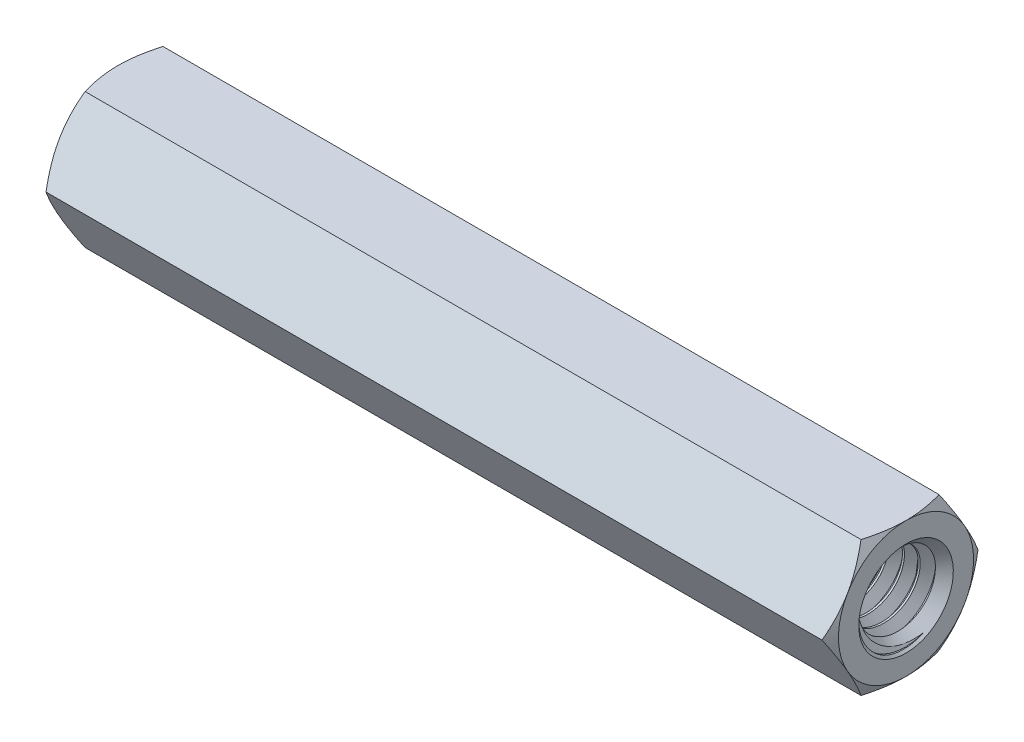
from build123d import *
from build123d.topology import SkipClean

# Parameters (mm, degrees)
BOSS_EXTRUDE1_DEPTH          = 35
SKETCH4_OUTSIDE_W            = 141.906
SKETCH4_OUTSIDE_H            = 140.978
SKETCH4_OUTSIDE_R            = 3
CUT_EXTRUDE1_DEPTH           = 36.298725189
CUT_EXTRUDE1_DRAFT           = -60
SKETCH5_OUTSIDE_W            = 141.906
SKETCH5_OUTSIDE_H            = 140.978
SKETCH5_OUTSIDE_R            = 3
CUT_EXTRUDE2_DEPTH           = 36.298725189
CUT_EXTRUDE2_DRAFT           = -60
SWEEP1_PITCH                 = 0.7
LPATTERN1_COUNT              = 2
LPATTERN1_PITCH              = 24
SKETCH8_R                    = 2.1
CUT_EXTRUDE3_OTHER_WAY_DEPTH = 37.017969724
CUT_EXTRUDE3_OTHER_WAY_TAPER = -45
SKETCH9_R                    = 2.1
CUT_EXTRUDE4_OTHER_WAY_DEPTH = 36.298725289
CUT_EXTRUDE4_OTHER_WAY_TAPER = -45


with BuildPart() as part:
    # Sketch2 → Boss-Extrude1 (new body)
    with BuildSketch(Plane(origin=(0, 0, 0), x_dir=(0, 0, -1), z_dir=(1, 0, 0))):
        Polygon((1.732050808, 3), (-1.732050808, 3), (-3.464101615, 0), (-1.732050808, -3), (1.732050808, -3), (3.464101615, 0), align=None)
    extrude(amount=BOSS_EXTRUDE1_DEPTH)

    # Sketch3 → Cut-Revolve1 (revolve, cut)
    with BuildSketch(Plane.XY, mode=Mode.PRIVATE) as cut_revolve1_sk:
        Polygon((0, 2.1), (0.1, 2), (11, 2), (11, 0), (0, 0), align=None)
        Polygon((35, 0), (24, 0), (24, 2), (34.9, 2), (35, 2.1), align=None)
    revolve(cut_revolve1_sk.sketch.rotate(Axis((0, 0, 0), (1, 0, 0)), 180), axis=Axis((0, 0, 0), (1, 0, 0)), mode=Mode.SUBTRACT)


with BuildPart() as cut_extrude1_tool:
    # Sketch4 outside → Cut-Extrude1 (with draft: the straight prism first)
    with BuildSketch(Plane.ZY):
        Rectangle(SKETCH4_OUTSIDE_W, SKETCH4_OUTSIDE_H)
        Circle(SKETCH4_OUTSIDE_R, mode=Mode.SUBTRACT)
    extrude(amount=-CUT_EXTRUDE1_DEPTH)
    # Cut-Extrude1: the draft: its side faces are tilted about the plane it starts from
    cut_extrude1_sides = [cut_extrude1_tool.faces().sort_by_distance(p)[0] for p in [
        (18.149362595, -70.489, 0),
        (18.149362595, 0, 70.953),
        (18.149362595, 70.489, 0),
        (18.149362595, 0, -70.953),
        (18.149362595, 0, -3),
    ]]
    draft(cut_extrude1_sides, Plane.ZY, CUT_EXTRUDE1_DRAFT)


with BuildPart() as part_1:
    add(part.part)

    # Cut-Extrude1: cut by cut_extrude1_tool
    add(cut_extrude1_tool.part, mode=Mode.SUBTRACT)


with BuildPart() as cut_extrude2_tool:
    # Sketch5 outside → Cut-Extrude2 (with draft: the straight prism first)
    with BuildSketch(Plane(origin=(35, 0, 0), x_dir=(0, 0, -1), z_dir=(1, 0, 0))):
        Rectangle(SKETCH5_OUTSIDE_W, SKETCH5_OUTSIDE_H)
        Circle(SKETCH5_OUTSIDE_R, mode=Mode.SUBTRACT)
    extrude(amount=-CUT_EXTRUDE2_DEPTH)
    # Cut-Extrude2: the draft: its side faces are tilted about the plane it starts from
    cut_extrude2_sides = [cut_extrude2_tool.faces().sort_by_distance(p)[0] for p in [
        (16.850637405, -70.489, 0),
        (16.850637405, 0, -70.953),
        (16.850637405, 70.489, 0),
        (16.850637405, 0, 70.953),
        (16.850637405, 0, 3),
    ]]
    draft(cut_extrude2_sides, Plane(origin=(35, 0, 0), x_dir=(0, 0, -1), z_dir=(1, 0, 0)), CUT_EXTRUDE2_DRAFT)


with BuildPart() as part_2:
    add(part_1.part)

    # Cut-Extrude2: cut by cut_extrude2_tool
    add(cut_extrude2_tool.part, mode=Mode.SUBTRACT)


with BuildPart() as body_2:
    # Sweep1: arcs per turn and ends read off the stored shape
    # Sweep1: the profile of Sketch6 screwed along a right-hand helix through 16.714286 turns, 6 arcs to a turn; built about Z, then put on its axis
    sweep1_z = Axis((0, 0, 0), (0, 0, 1))
    sweep1_corners = [(2.04375, 0, -0.624222777), (2.04375, 0, 0.025259074), (1.55705944, 0, -0.255731851), (1.55705944, 0, -0.343231851)]
    with BuildLine(mode=Mode.PRIVATE) as sweep1_profile:
        Line(sweep1_corners[0], sweep1_corners[1])
        Line(sweep1_corners[1], sweep1_corners[2])
        Line(sweep1_corners[2], sweep1_corners[3])
        Line(sweep1_corners[3], sweep1_corners[0])
    sweep1_cap = Face(sweep1_profile.wire())
    sweep1_turn_angles = [0, 30, 60, 90, 120, 150, 180, 210, 240, 270, 300, 330, 360]
    sweep1_turn_weights = [1, 0.8660254037844387, 1, 0.8660254037844387, 1, 0.8660254037844387, 1, 0.8660254037844387, 1, 0.8660254037844387, 1, 0.8660254037844387, 1]
    sweep1_turn_rails = [Edge.make_bspline([Vector(p[0], p[1], 0).rotate(sweep1_z, sweep1_turn_angles[k]) / sweep1_turn_weights[k] + Vector(0, 0, p[2] + SWEEP1_PITCH * sweep1_turn_angles[k] / 360) for k in range(13)], [0, 0, 0, 1, 1, 2, 2, 3, 3, 4, 4, 5, 5, 6, 6, 6], 2, sweep1_turn_weights) for p in sweep1_corners]
    sweep1_turn_sides = [Face.make_surface_from_curves(sweep1_turn_rails[p[0]], sweep1_turn_rails[p[1]]) for p in [(0, 1), (1, 2), (2, 3), (3, 0)]]
    sweep1_last_angles = [5760, 5790, 5820, 5850, 5880, 5910, 5940, 5970, 6000, 6008.571428571, 6017.142857143]
    sweep1_last_weights = [1, 0.8660254037844387, 1, 0.8660254037844387, 1, 0.8660254037844387, 1, 0.8660254037844387, 1, 0.9888308262251301, 1]
    sweep1_last_rails = [Edge.make_bspline([Vector(p[0], p[1], 0).rotate(sweep1_z, sweep1_last_angles[k]) / sweep1_last_weights[k] + Vector(0, 0, p[2] + SWEEP1_PITCH * sweep1_last_angles[k] / 360) for k in range(11)], [0, 0, 0, 1, 1, 2, 2, 3, 3, 4, 4, 5, 5, 5], 2, sweep1_last_weights) for p in sweep1_corners]
    sweep1_last_sides = [Face.make_surface_from_curves(sweep1_last_rails[p[0]], sweep1_last_rails[p[1]]) for p in [(0, 1), (1, 2), (2, 3), (3, 0)]]
    sweep1 = Plane(origin=(0, 0, 0), x_dir=(0, 1, 0), z_dir=(1, 0, 0)) * Solid(Shell([*[p.moved(Location((0, 0, SWEEP1_PITCH * i))) for i in range(16) for p in sweep1_turn_sides], *sweep1_last_sides, sweep1_cap, sweep1_cap.rotate(sweep1_z, 6017.142857143).moved(Location((0, 0, SWEEP1_PITCH * 6017.142857143 / 360)))]))
    add(sweep1)


with BuildPart() as lpattern1_1:
    # LPattern1: Sweep1 ×2
    with Locations(*[(i * LPATTERN1_PITCH, 0, 0) for i in range(1, LPATTERN1_COUNT)]):
        add(sweep1)


with BuildPart() as part_3:
    add(part_2.part)

    # Combine1: union body 2, LPattern1_1
    add(body_2.part)
    add(lpattern1_1.part)

    # Cut-Extrude3 cone 1 section (through the dimple's axis) → Cut-Extrude3 (revolve, cut)
    with BuildSketch(Plane.ZX):
        Polygon((0, 0), (2.1, 0), (0, 2.1), align=None)
    revolve(axis=Axis((0, 0, 0), (1, 0, 0)), mode=Mode.SUBTRACT)

    # Sketch8 → Cut-Extrude3 other way (cut)
    with BuildSketch(Plane.ZY):
        Circle(SKETCH8_R)
    extrude(amount=CUT_EXTRUDE3_OTHER_WAY_DEPTH, taper=CUT_EXTRUDE3_OTHER_WAY_TAPER, mode=Mode.SUBTRACT)

    # Cut-Extrude4 cone 1 section (through the dimple's axis) → Cut-Extrude4 (revolve, cut)
    with SkipClean():  # the faces are left unmerged after this step: merging them gives an invalid solid
        with BuildSketch(Plane(origin=(35, 0, 0), x_dir=(0, 0, -1), z_dir=(0, 1, 0))):
            Polygon((0, 0), (2.1, 0), (0, 2.1), align=None)
        revolve(axis=Axis((35, 0, 0), (-1, 0, 0)), mode=Mode.SUBTRACT)

    # Sketch9 → Cut-Extrude4 other way (cut)
    with SkipClean():  # the faces are left unmerged after this step: merging them gives an invalid solid
        with BuildSketch(Plane(origin=(35, 0, 0), x_dir=(0, 0, -1), z_dir=(1, 0, 0))):
            Circle(SKETCH9_R)
        extrude(amount=CUT_EXTRUDE4_OTHER_WAY_DEPTH, taper=CUT_EXTRUDE4_OTHER_WAY_TAPER, mode=Mode.SUBTRACT)


solid = part_3.part
